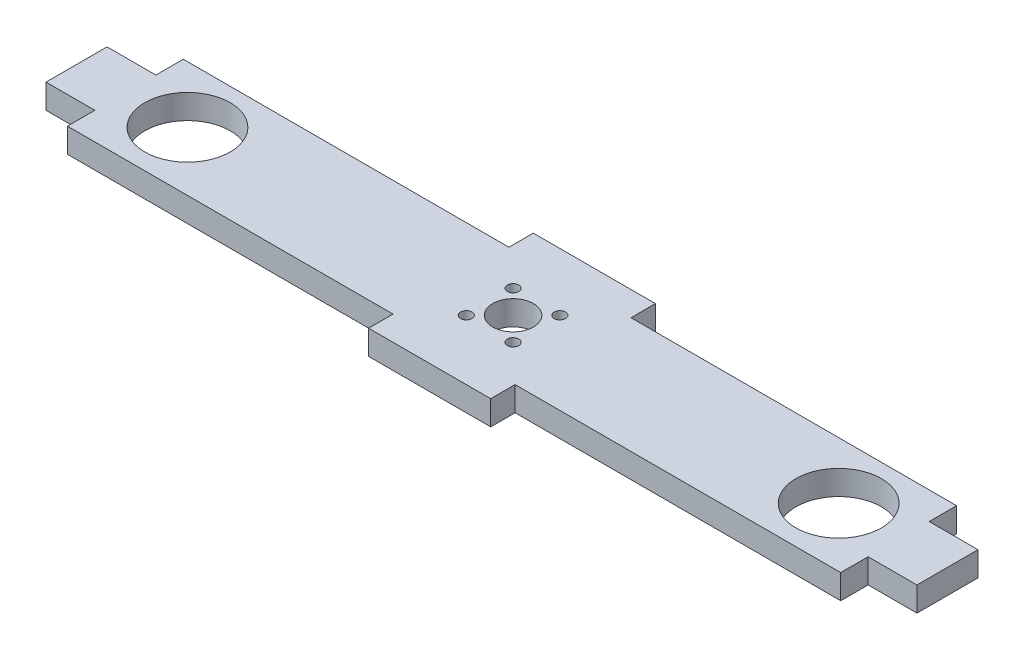
from build123d import *

# Parameters (mm, degrees)
SKETCH_1_R      = 10.5
SKETCH_1_R_2    = 5
SKETCH_1_R_3    = 1.4
EXTRUDE_1_DEPTH = 6


with BuildPart() as part:
    # Эскиз1 → Бобышка-Вытянуть1 (new body)
    with BuildSketch(Plane(origin=(0, 0, 0), x_dir=(1, 0, 0), z_dir=(0, 1, 0))):
        Polygon((-95, 14.235), (-15, 14.235), (-15, 20.235), (15, 20.235), (15, 14.235), (95, 14.235), (95, 7.5), (107, 7.5), (107, -7.5), (95, -7.5), (95, -14.235), (15, -14.235), (15, -20.235), (-15, -20.235), (-15, -14.235), (-95, -14.235), (-95, -7.5), (-107, -7.5), (-107, 7.5), (-95, 7.5), align=None)
        with Locations((-80, 0.265)):
            Circle(SKETCH_1_R, mode=Mode.SUBTRACT)
        with Locations((80, 0.265)):
            Circle(SKETCH_1_R, mode=Mode.SUBTRACT)
        with Locations((0, 0.265)):
            Circle(SKETCH_1_R_2, mode=Mode.SUBTRACT)
        with Locations((-5.75, 6.015)):
            Circle(SKETCH_1_R_3, mode=Mode.SUBTRACT)
        with Locations((5.75, 6.015)):
            Circle(SKETCH_1_R_3, mode=Mode.SUBTRACT)
        with Locations((5.75, -5.485)):
            Circle(SKETCH_1_R_3, mode=Mode.SUBTRACT)
        with Locations((-5.75, -5.485)):
            Circle(SKETCH_1_R_3, mode=Mode.SUBTRACT)
    extrude(amount=EXTRUDE_1_DEPTH)


solid = part.part
